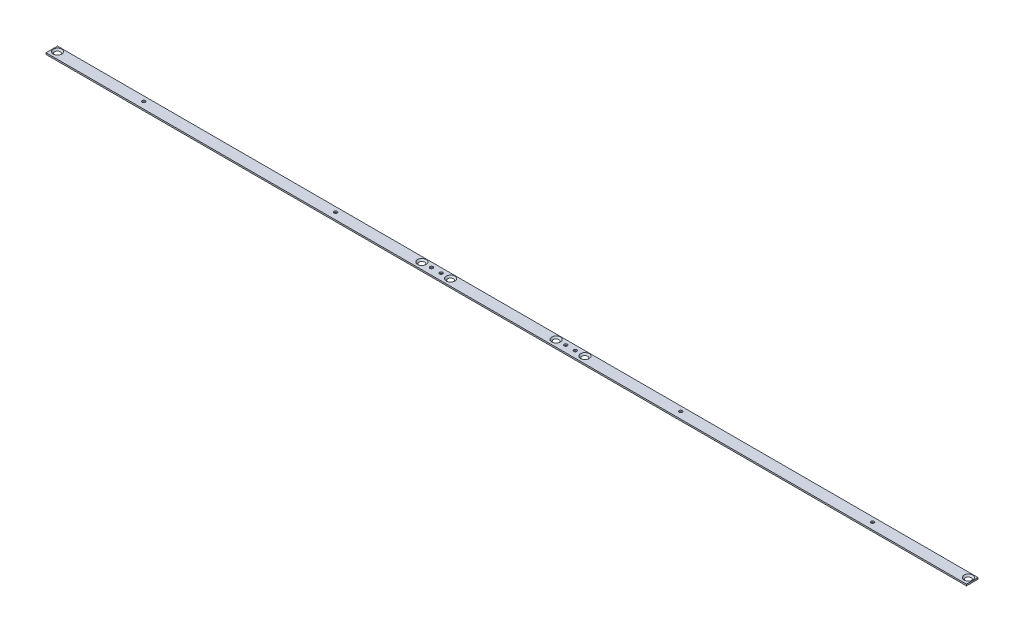
from build123d import *

# Parameters (mm, degrees)
SKETCH1_W                    = 960
SKETCH1_H                    = 12
BOSS_EXTRUDE1_DEPTH          = 1.5875
CSK_FOR_M4_SFHCS1_AT_2_COUNT = 2
CSK_FOR_M4_SFHCS1_AT_2_PITCH = 570
CSK_FOR_M4_SFHCS1_AT_3_COUNT = 2
CSK_FOR_M4_SFHCS1_AT_3_PITCH = 540
CSK_FOR_M4_SFHCS1_AT_4_COUNT = 2
CSK_FOR_M4_SFHCS1_AT_4_PITCH = 430
CSK_FOR_M4_SFHCS1_AT_5_COUNT = 2
CSK_FOR_M4_SFHCS1_AT_5_PITCH = 400
CSK_FOR_M4_SFHCS1_AT_6_COUNT = 2
CSK_FOR_M4_SFHCS1_AT_6_PITCH = 950
M4X0_7_TAPPED_HOLE2_D        = 3.3


with BuildPart() as part:
    # Sketch1 → Boss-Extrude1 (new body)
    with BuildSketch(Plane(origin=(0, 0, 0), x_dir=(1, 0, 0), z_dir=(0, 1, 0))):
        Rectangle(SKETCH1_W, SKETCH1_H)
    extrude(amount=BOSS_EXTRUDE1_DEPTH)

    # Sketch3 → CSK for M4 SFHCS1 (revolve, cut)
    with BuildSketch(Plane(origin=(475, 1.5875, -1), x_dir=(0, 0, 1), z_dir=(1, 0, 0))):
        Polygon((0, 0), (0, 1.5875), (2.25, 1.5875), (2.25, 2.23), (4.48, 0), align=None)
    csk_for_m4_sfhcs1 = revolve(axis=Axis((475, 7.9375, -1), (0, -1, 0)), mode=Mode.SUBTRACT)

    # CSK for M4 SFHCS1 at 2: CSK for M4 SFHCS1 ×2
    with Locations(*[(-i * CSK_FOR_M4_SFHCS1_AT_2_PITCH, 0, 0) for i in range(1, CSK_FOR_M4_SFHCS1_AT_2_COUNT)]):
        add(csk_for_m4_sfhcs1, mode=Mode.SUBTRACT)

    # CSK for M4 SFHCS1 at 3: CSK for M4 SFHCS1 ×2
    with Locations(*[(-i * CSK_FOR_M4_SFHCS1_AT_3_PITCH, 0, 0) for i in range(1, CSK_FOR_M4_SFHCS1_AT_3_COUNT)]):
        add(csk_for_m4_sfhcs1, mode=Mode.SUBTRACT)

    # CSK for M4 SFHCS1 at 4: CSK for M4 SFHCS1 ×2
    with Locations(*[(-i * CSK_FOR_M4_SFHCS1_AT_4_PITCH, 0, 0) for i in range(1, CSK_FOR_M4_SFHCS1_AT_4_COUNT)]):
        add(csk_for_m4_sfhcs1, mode=Mode.SUBTRACT)

    # CSK for M4 SFHCS1 at 5: CSK for M4 SFHCS1 ×2
    with Locations(*[(-i * CSK_FOR_M4_SFHCS1_AT_5_PITCH, 0, 0) for i in range(1, CSK_FOR_M4_SFHCS1_AT_5_COUNT)]):
        add(csk_for_m4_sfhcs1, mode=Mode.SUBTRACT)

    # CSK for M4 SFHCS1 at 6: CSK for M4 SFHCS1 ×2
    with Locations(*[(-i * CSK_FOR_M4_SFHCS1_AT_6_PITCH, 0, 0) for i in range(1, CSK_FOR_M4_SFHCS1_AT_6_COUNT)]):
        add(csk_for_m4_sfhcs1, mode=Mode.SUBTRACT)

    # M4x0.7 Tapped Hole2 (through all)
    with Locations(Plane(origin=(0, 1.5875, 0), x_dir=(1, 0, 0), z_dir=(0, 1, 0))):
        with Locations((-85, 1), (-75, 1), (55, 1), (65, 1), (175, 1), (375, 1), (-385, 1), (-185, 1)):
            Hole(M4X0_7_TAPPED_HOLE2_D / 2)


solid = part.part
